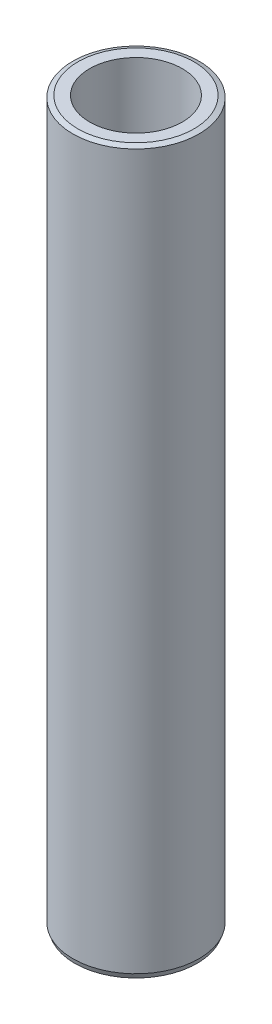
from build123d import *
from OCP.BRepFilletAPI import BRepFilletAPI_MakeChamfer

# Parameters (mm, degrees)
SKETCH1_R           = 52.5
BOSS_EXTRUDE1_DEPTH = 600
SKETCH2_R           = 38.557907838
CUT_EXTRUDE1_DEPTH  = 605.576297914
CHAMFER1_SIZE       = 1.574043402
CHAMFER1_SIZE2      = 4.162240405


with BuildPart() as part:
    # Sketch1 → Boss-Extrude1 (new body)
    with BuildSketch(Plane(origin=(0, 0, 0), x_dir=(1, 0, 0), z_dir=(0, 1, 0))):
        Circle(SKETCH1_R)
    extrude(amount=BOSS_EXTRUDE1_DEPTH)

    # Sketch2 → Cut-Extrude1 (cut, through all)
    with BuildSketch(Plane(origin=(0, 0, 0), x_dir=(1, 0, 0), z_dir=(0, 1, 0))):
        Circle(SKETCH2_R)
    extrude(amount=CUT_EXTRUDE1_DEPTH, mode=Mode.SUBTRACT)

    # Chamfer1: one chamfer whose edges measure the first distance from different faces: ONE call of the kernel's chamfer builder (chamfer() names one face for all edges)
    chamfer1_edges_1 = [part.edges().sort_by_distance(p)[0] for p in [
        (-52.5, 600, 0),
    ]]
    chamfer1_side_1 = [part.faces().sort_by_distance(p)[0] for p in [
        (-52.5, 300, 0),
    ]]
    chamfer1_edges_2 = [part.edges().sort_by_distance(p)[0] for p in [
        (-52.5, 0, 0),
    ]]
    chamfer1_side_2 = [part.faces().sort_by_distance(p)[0] for p in [
        (-51.01507576, 0, 0),
    ]]
    chamfer1 = BRepFilletAPI_MakeChamfer(part.part.solid().wrapped)
    for e in chamfer1_edges_1:
        chamfer1.Add(CHAMFER1_SIZE, CHAMFER1_SIZE2, e.wrapped, chamfer1_side_1[0].wrapped)  # the first distance lies on this face
    for e in chamfer1_edges_2:
        chamfer1.Add(CHAMFER1_SIZE, CHAMFER1_SIZE2, e.wrapped, chamfer1_side_2[0].wrapped)  # the first distance lies on this face
    add(Compound.cast(chamfer1.Shape()), mode=Mode.REPLACE)


solid = part.part
